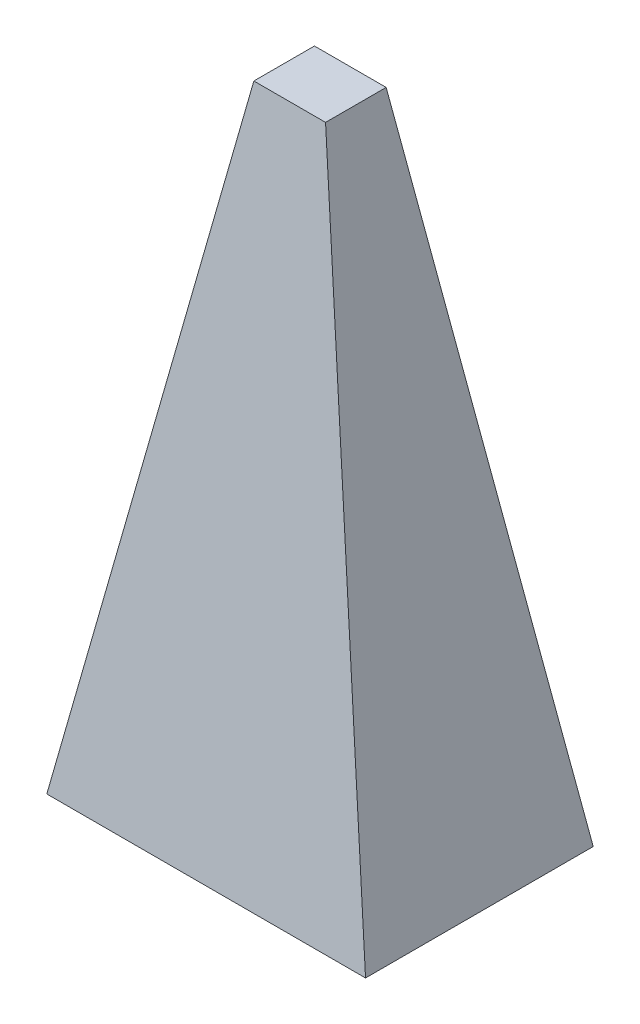
from build123d import *

# Parameters (mm, degrees)
BOSS_EXTRUDE1_DEPTH = 44.45
CUT_EXTRUDE1_DEPTH  = 79.375
SKETCH3_R           = 3.96875
CUT_EXTRUDE2_DEPTH  = 25


with BuildPart() as part:
    # Sketch1 → Boss-Extrude1 (new, symmetric)
    with BuildSketch(Plane(origin=(0, 0, 0), x_dir=(0, 0, -1), z_dir=(1, 0, 0))):
        Polygon((-31.75, 0), (31.75, 0), (8.45, 177.8), (-8.45, 177.8), align=None)
    extrude(amount=BOSS_EXTRUDE1_DEPTH, both=True)

    # Sketch2 → Cut-Extrude1 (cut, symmetric)
    with BuildSketch(Plane.XY):
        Polygon((-44.45, 0), (-10, 177.8), (-59.45, 177.8), (-59.45, 0), align=None)
        Polygon((44.45, 0), (10, 177.8), (59.45, 177.8), (59.45, 0), align=None)
    extrude(amount=CUT_EXTRUDE1_DEPTH, both=True, mode=Mode.SUBTRACT)

    # Sketch3 → Cut-Extrude2 (cut, symmetric)
    with BuildSketch(Plane(origin=(0, 0, 0), x_dir=(1, 0, 0), z_dir=(0, 1, 0))):
        with Locations((-31.75, 0)):
            Circle(SKETCH3_R)
        with Locations((31.75, 0)):
            Circle(SKETCH3_R)
    extrude(amount=CUT_EXTRUDE2_DEPTH, both=True, mode=Mode.SUBTRACT)


solid = part.part
